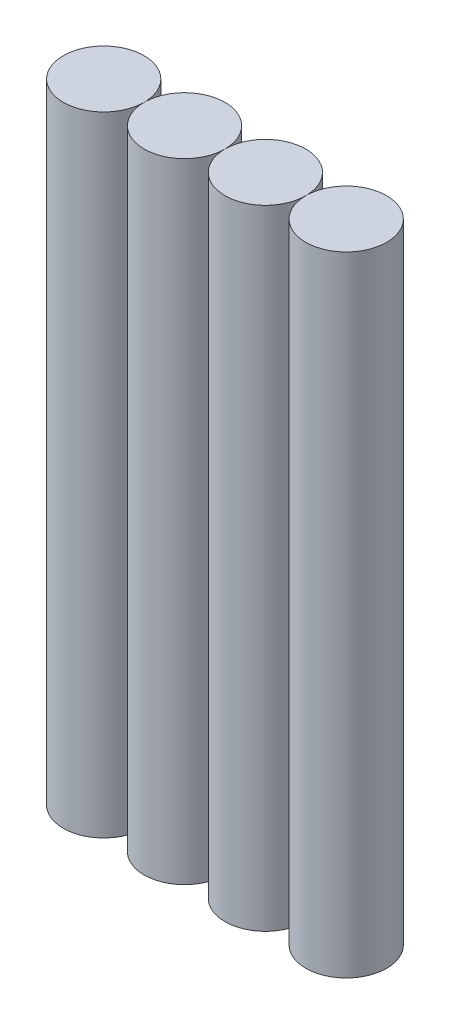
from build123d import *

# Parameters (mm, degrees)
BOSS_EXTRUDE1_DEPTH   = 140
SKETCH1_R             = 9
BOSS_EXTRUDE1_2_DEPTH = 140
BOSS_EXTRUDE1_3_DEPTH = 140
BOSS_EXTRUDE1_4_DEPTH = 140


with BuildPart() as part:
    # Sketch1 → Boss-Extrude1 (new body)
    with BuildSketch(Plane(origin=(0, 0, 0), x_dir=(1, 0, 0), z_dir=(0, 1, 0))):
        with BuildLine():
            ThreePointArc((27, 0), (18, 9), (9, 0))
            ThreePointArc((9, 0), (18, -9), (27, 0))
        make_face()
    extrude(amount=BOSS_EXTRUDE1_DEPTH)


with BuildPart() as body_2:
    # Sketch1 → Boss-Extrude1 2 (new body)
    with BuildSketch(Plane(origin=(0, 0, 0), x_dir=(1, 0, 0), z_dir=(0, 1, 0))):
        Circle(SKETCH1_R)
    extrude(amount=BOSS_EXTRUDE1_2_DEPTH)


with BuildPart() as body_3:
    # Sketch1 → Boss-Extrude1 3 (new body)
    with BuildSketch(Plane(origin=(0, 0, 0), x_dir=(1, 0, 0), z_dir=(0, 1, 0))):
        with Locations((54, 0)):
            Circle(SKETCH1_R)
    extrude(amount=BOSS_EXTRUDE1_3_DEPTH)


with BuildPart() as body_4:
    # Sketch1 → Boss-Extrude1 4 (new body)
    with BuildSketch(Plane(origin=(0, 0, 0), x_dir=(1, 0, 0), z_dir=(0, 1, 0))):
        with BuildLine():
            ThreePointArc((45, 0), (36, 9), (27, 0))
            ThreePointArc((27, 0), (36, -9), (45, 0))
        make_face()
    extrude(amount=BOSS_EXTRUDE1_4_DEPTH)


solid = Compound([part.part, body_2.part, body_3.part, body_4.part])
